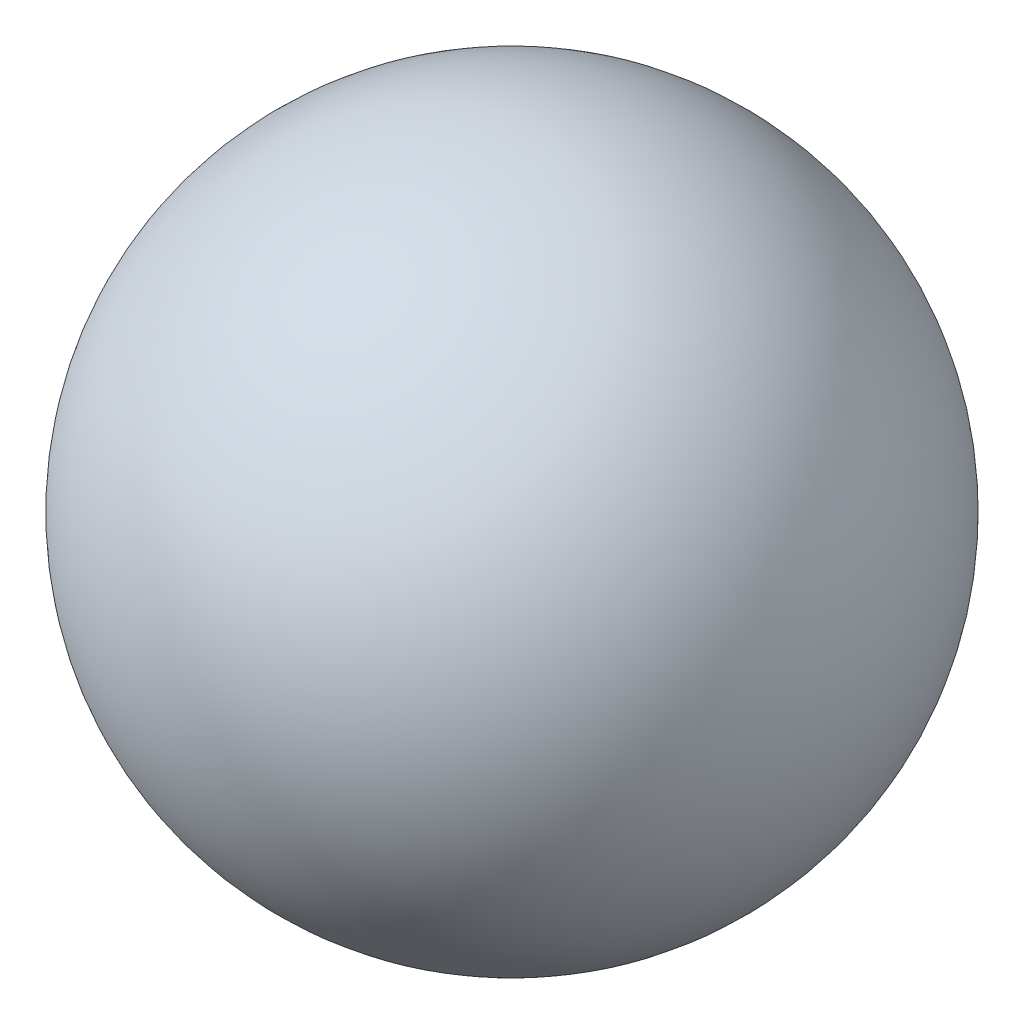
from build123d import *


with BuildPart() as part:
    # Sketch2 → Revolve2 (revolve)
    with BuildSketch(Plane.XY):
        with BuildLine():
            Line((0, 100), (0, -100))
            ThreePointArc((0, -100), (-100, 0), (0, 100))
        make_face()
    revolve(axis=Axis((0, -11, 0), (0, 1, 0)))


solid = part.part
